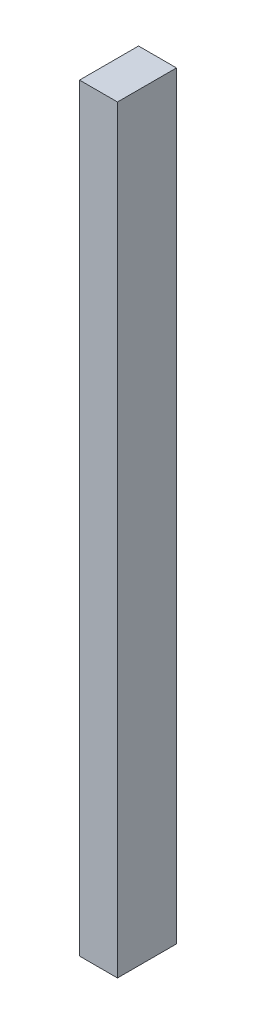
from build123d import *

# Parameters (mm, degrees)
SKETCH1_W           = 45
SKETCH1_H           = 70
BOSS_EXTRUDE1_DEPTH = 900


with BuildPart() as part:
    # Sketch1 → Boss-Extrude1 (new body)
    with BuildSketch(Plane(origin=(0, 0, 0), x_dir=(1, 0, 0), z_dir=(0, 1, 0))):
        with Locations((22.5, 35)):
            Rectangle(SKETCH1_W, SKETCH1_H)
    extrude(amount=BOSS_EXTRUDE1_DEPTH)


solid = part.part
